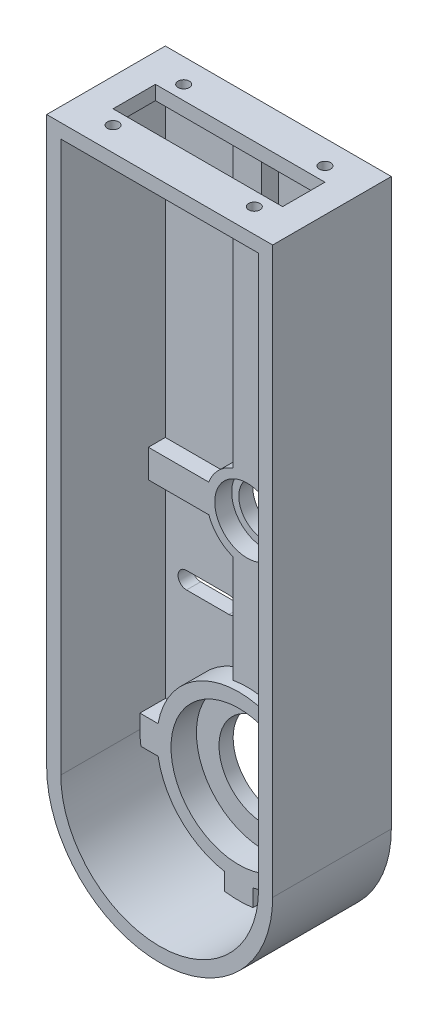
from build123d import *

# Parameters (mm, degrees)
ESBO_O1_R                   = 16
RESSALTO_EXTRUS_O1_DEPTH    = 42
CASCA1_T                    = -5
ESBO_O3_R                   = 2
ESBO_O3_W                   = 60
ESBO_O3_H                   = 15
CORTE_EXTRUS_O1_DEPTH       = 5
ESBO_O4_R                   = 29
ESBO_O4_R_2                 = 24
RESSALTO_EXTRUS_O2_DEPTH    = 9
ESBO_O5_R                   = 9
CORTE_EXTRUS_O2_DEPTH       = 5
ESBO_O6_R                   = 14.5
ESBO_O6_R_2                 = 11.5
RESSALTO_EXTRUS_O3_DEPTH    = 6
NERVURA1_REACH              = 150.27
ESBO_O7_WALLS_W             = 304.540047886
ESBO_O7_WALLS_H             = 10
ESBO_O7_WALLS_W_2           = 10
ESBO_O7_WALLS_H_2           = 304.540047886
NERVURA2_REACH              = 150.866
ESBO_O8_WALLS_W             = 320.231422594
ESBO_O8_WALLS_H             = 10
ESBO_O8_WALLS_W_2           = 10
ESBO_O8_WALLS_H_2           = 400.231422594
ESBO_O8_WALLS_H_3           = 336.231422594
CORTE_EXTRUS_O3_DEPTH       = 5
ESBO_O10_R                  = 1.2
CORTE_EXTRUS_O4_DEPTH       = 5
RESSALTO_EXTRUS_O4_DEPTH    = 4
FILETE1_R                   = 1.5
PADR_O_LINEAR1_COUNT        = 3
PADR_O_LINEAR1_PITCH        = 65
FILETE1_OF_PADR_O_LINEAR1_R = 1.5


with BuildPart() as part:
    # Esboço1 → Ressalto-extrusão1 (new body)
    with BuildSketch(Plane.XY):
        with BuildLine():
            Line((-40, -100), (-40, 100))
            Line((-40, 100), (40, 100))
            Line((40, 100), (40, -100))
            ThreePointArc((40, -100), (0, -140), (-40, -100))
        make_face()
        with Locations(Location((0, -100, 0), (0, 0, 180))):
            Circle(ESBO_O1_R, mode=Mode.SUBTRACT)
    extrude(amount=RESSALTO_EXTRUS_O1_DEPTH)

    # Casca1
    casca1_openings = [part.faces().sort_by_distance(p)[0] for p in [
        (0, -12.059912395, 42),
        (16, -100, 21),
    ]]
    offset(amount=CASCA1_T, openings=casca1_openings, kind=Kind.INTERSECTION)

    # Esboço3 → Corte-extrusão1 (cut)
    with BuildSketch(Plane(origin=(0, 100, 0), x_dir=(1, 0, 0), z_dir=(0, 1, 0))):
        with Locations(Location((25, -33.5, 0), (0, 0, 270))):
            Circle(ESBO_O3_R)
        with Locations(Location((-25, -33.5, 0), (0, 0, 270))):
            Circle(ESBO_O3_R)
        with Locations(Location((-25, -8.5, 0), (0, 0, 270))):
            Circle(ESBO_O3_R)
        with Locations(Location((25, -8.5, 0), (0, 0, 270))):
            Circle(ESBO_O3_R)
        with Locations((0, -21)):
            Rectangle(ESBO_O3_W, ESBO_O3_H)
    extrude(amount=-CORTE_EXTRUS_O1_DEPTH, mode=Mode.SUBTRACT)

    # Esboço4 → Ressalto-extrusão2 (add)
    with BuildSketch(Plane.XY.offset(5)):
        with Locations((0, -100)):
            Circle(ESBO_O4_R)
        with Locations((0, -100)):
            Circle(ESBO_O4_R_2, mode=Mode.SUBTRACT)
    extrude(amount=RESSALTO_EXTRUS_O2_DEPTH)

    # Esboço5 → Corte-extrusão2 (cut)
    with BuildSketch(Plane.XY.offset(5)):
        with Locations((0, -20)):
            Circle(ESBO_O5_R)
    extrude(amount=-CORTE_EXTRUS_O2_DEPTH, mode=Mode.SUBTRACT)

    # Esboço6 → Ressalto-extrusão3 (add)
    with BuildSketch(Plane.XY.offset(5)):
        with Locations((0, -20)):
            Circle(ESBO_O6_R)
        with Locations((0, -20)):
            Circle(ESBO_O6_R_2, mode=Mode.SUBTRACT)
    extrude(amount=RESSALTO_EXTRUS_O3_DEPTH)

    # Esboço7 walls → Nervura1 (add, up to next)
    with BuildSketch(Plane.XY.offset(14), mode=Mode.PRIVATE) as nervura1_sk1:
        with Locations((32, -100)):
            Rectangle(ESBO_O7_WALLS_W, ESBO_O7_WALLS_H)
    nervura1_tool1 = extrude(nervura1_sk1.sketch, amount=-NERVURA1_REACH, mode=Mode.PRIVATE) - part.part
    # Esboço7 walls → Nervura1 (add, up to next)
    with BuildSketch(Plane.XY.offset(14), mode=Mode.PRIVATE) as nervura1_sk2:
        with Locations((-32, -100)):
            Rectangle(ESBO_O7_WALLS_W, ESBO_O7_WALLS_H)
    nervura1_tool2 = extrude(nervura1_sk2.sketch, amount=-NERVURA1_REACH, mode=Mode.PRIVATE) - part.part
    # Esboço7 walls → Nervura1 (add, up to next)
    with BuildSketch(Plane.XY.offset(14), mode=Mode.PRIVATE) as nervura1_sk3:
        with Locations((0, -132)):
            Rectangle(ESBO_O7_WALLS_W_2, ESBO_O7_WALLS_H_2)
    nervura1_tool3 = extrude(nervura1_sk3.sketch, amount=-NERVURA1_REACH, mode=Mode.PRIVATE) - part.part
    add(nervura1_tool1.solids().sort_by_distance((32, -100, 14))[0])
    add(nervura1_tool2.solids().sort_by_distance((-32, -100, 14))[0])
    add(nervura1_tool3.solids().sort_by_distance((0, -132, 14))[0])

    # Esboço8 walls → Nervura2 (add, up to next)
    with BuildSketch(Plane.XY.offset(11), mode=Mode.PRIVATE) as nervura2_sk1:
        with Locations((24.75, -20)):
            Rectangle(ESBO_O8_WALLS_W, ESBO_O8_WALLS_H)
    nervura2_tool1 = extrude(nervura2_sk1.sketch, amount=-NERVURA2_REACH, mode=Mode.PRIVATE) - part.part
    # Esboço8 walls → Nervura2 (add, up to next)
    with BuildSketch(Plane.XY.offset(11), mode=Mode.PRIVATE) as nervura2_sk2:
        with Locations((-24.75, -20)):
            Rectangle(ESBO_O8_WALLS_W, ESBO_O8_WALLS_H)
    nervura2_tool2 = extrude(nervura2_sk2.sketch, amount=-NERVURA2_REACH, mode=Mode.PRIVATE) - part.part
    # Esboço8 walls → Nervura2 (add, up to next)
    with BuildSketch(Plane.XY.offset(11), mode=Mode.PRIVATE) as nervura2_sk3:
        with Locations((0, 44.75)):
            Rectangle(ESBO_O8_WALLS_W_2, ESBO_O8_WALLS_H_2)
    nervura2_tool3 = extrude(nervura2_sk3.sketch, amount=-NERVURA2_REACH, mode=Mode.PRIVATE) - part.part
    # Esboço8 walls → Nervura2 (add, up to next)
    with BuildSketch(Plane.XY.offset(11), mode=Mode.PRIVATE) as nervura2_sk4:
        with Locations((0, -52.75)):
            Rectangle(ESBO_O8_WALLS_W_2, ESBO_O8_WALLS_H_3)
    nervura2_tool4 = extrude(nervura2_sk4.sketch, amount=-NERVURA2_REACH, mode=Mode.PRIVATE) - part.part
    add(nervura2_tool1.solids().sort_by_distance((24.75, -20, 11))[0])
    add(nervura2_tool2.solids().sort_by_distance((-24.75, -20, 11))[0])
    add(nervura2_tool3.solids().sort_by_distance((0, 44.75, 11))[0])
    add(nervura2_tool4.solids().sort_by_distance((0, -52.75, 11))[0])

    # Esboço9 → Corte-extrusão3 (cut)
    with BuildSketch(Plane.XY.offset(5)):
        with BuildLine():
            Line((-27.5, -52), (-12.5, -52))
            ThreePointArc((-12.5, -52), (-9.5, -55), (-12.5, -58))
            Line((-12.5, -58), (-27.5, -58))
            ThreePointArc((-27.5, -58), (-30.5, -55), (-27.5, -52))
        make_face()
    extrude(amount=-CORTE_EXTRUS_O3_DEPTH, mode=Mode.SUBTRACT)

    # Esboço10 → Corte-extrusão4 (cut)
    with BuildSketch(Plane.XY.offset(5)):
        with Locations((21.538461538, -66.293996461)):
            Circle(ESBO_O10_R)
        with Locations((28.694536951, -60.045749932)):
            Circle(ESBO_O10_R)
        Polygon((14.683545029, -56.348769838), (22.216255989, -49.771668228), (19.585415345, -46.758583844), (12.052704385, -53.335685454), align=None)
    extrude(amount=-CORTE_EXTRUS_O4_DEPTH, mode=Mode.SUBTRACT)

    # Esboço11 → Ressalto-extrusão4 (add)
    with BuildSketch(Plane(origin=(0, -65, 0), x_dir=(-1, 0, 0), z_dir=(0, -1, 0))):
        Polygon((-40, -21), (-31, -21), (-31, -36), (-33, -36), (-33, -26), (-40, -26), align=None)
    ressalto_extrus_o4 = extrude(amount=RESSALTO_EXTRUS_O4_DEPTH)

    # Filete1
    # the kernel refuses this fillet: 1.5 mm, written as the material it takes off along each edge
    with BuildSketch(Plane(origin=(31, -61.25, 21), x_dir=(1, 0, 0), z_dir=(0, -1, 0)), Plane(origin=(31, -61.25, 36), x_dir=(0, 0, -1), z_dir=(0, -1, 0))) as filete1_piece_1:
        with BuildLine():
            CenterArc((FILETE1_R, FILETE1_R), FILETE1_R, 180, 90)
            Line((0, FILETE1_R), (0, 0))
            Line((0, 0), (FILETE1_R, 0))
        make_face()
    extrude(amount=11.5, mode=Mode.SUBTRACT)
    with BuildSketch(Plane(origin=(33, -61.25, 36), x_dir=(0, 0, -1), z_dir=(0, -1, 0))) as filete1_piece_2:
        with BuildLine():
            CenterArc((FILETE1_R, -FILETE1_R), FILETE1_R, 90, 90)
            Line((0, -FILETE1_R), (0, 0))
            Line((0, 0), (FILETE1_R, 0))
        make_face()
    extrude(amount=11.5, mode=Mode.SUBTRACT)

    # Padrão linear1: Ressalto-extrusão4 ×3
    with Locations(*[(0, i * PADR_O_LINEAR1_PITCH, 0) for i in range(1, PADR_O_LINEAR1_COUNT)]):
        add(ressalto_extrus_o4)

    # Filete1 of Padrão linear1
    # the kernel refuses this fillet: 1.5 mm, written as the material it takes off along each edge
    with BuildSketch(Plane(origin=(31, 3.75, 21), x_dir=(1, 0, 0), z_dir=(0, -1, 0)), Plane(origin=(31, 3.75, 36), x_dir=(0, 0, -1), z_dir=(0, -1, 0)), Plane(origin=(31, 68.75, 21), x_dir=(1, 0, 0), z_dir=(0, -1, 0)), Plane(origin=(31, 68.75, 36), x_dir=(0, 0, -1), z_dir=(0, -1, 0))) as filete1_of_padr_o_linear1_piece_1:
        with BuildLine():
            CenterArc((FILETE1_OF_PADR_O_LINEAR1_R, FILETE1_OF_PADR_O_LINEAR1_R), FILETE1_OF_PADR_O_LINEAR1_R, 180, 90)
            Line((0, FILETE1_OF_PADR_O_LINEAR1_R), (0, 0))
            Line((0, 0), (FILETE1_OF_PADR_O_LINEAR1_R, 0))
        make_face()
    extrude(amount=11.5, mode=Mode.SUBTRACT)
    with BuildSketch(Plane(origin=(33, 3.75, 36), x_dir=(0, 0, -1), z_dir=(0, -1, 0)), Plane(origin=(33, 68.75, 36), x_dir=(0, 0, -1), z_dir=(0, -1, 0))) as filete1_of_padr_o_linear1_piece_2:
        with BuildLine():
            CenterArc((FILETE1_OF_PADR_O_LINEAR1_R, -FILETE1_OF_PADR_O_LINEAR1_R), FILETE1_OF_PADR_O_LINEAR1_R, 90, 90)
            Line((0, -FILETE1_OF_PADR_O_LINEAR1_R), (0, 0))
            Line((0, 0), (FILETE1_OF_PADR_O_LINEAR1_R, 0))
        make_face()
    extrude(amount=11.5, mode=Mode.SUBTRACT)


solid = part.part
